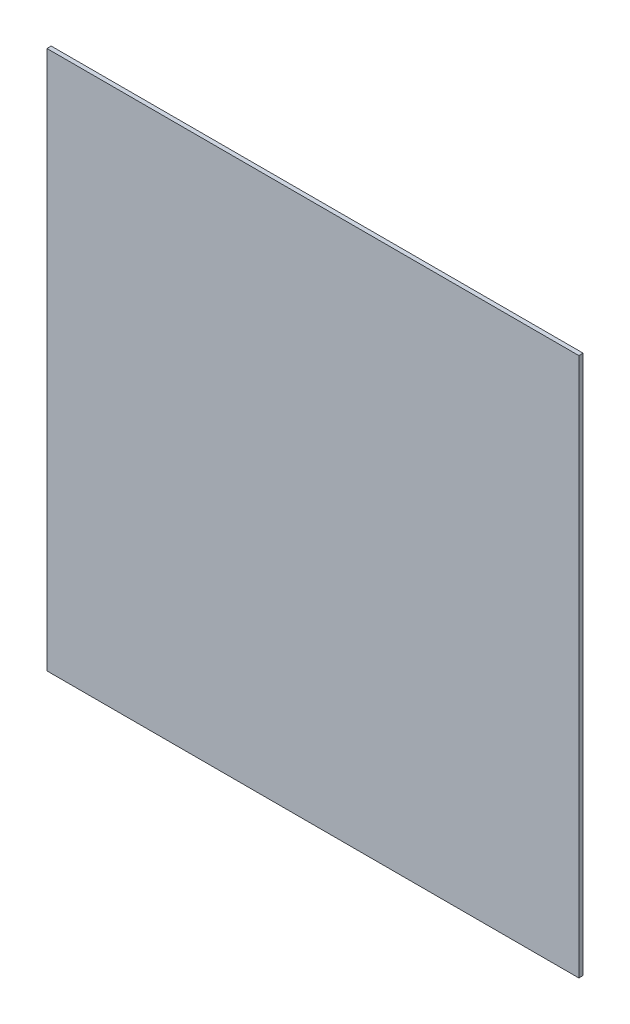
from build123d import *

# Parameters (mm, degrees)
SKETCH1_W           = 375
SKETCH1_H           = 380
BOSS_EXTRUDE1_DEPTH = 1.5


with BuildPart() as part:
    # Sketch1 → Boss-Extrude1 (new, symmetric)
    with BuildSketch(Plane.XY):
        Rectangle(SKETCH1_W, SKETCH1_H)
    extrude(amount=BOSS_EXTRUDE1_DEPTH, both=True)


solid = part.part
